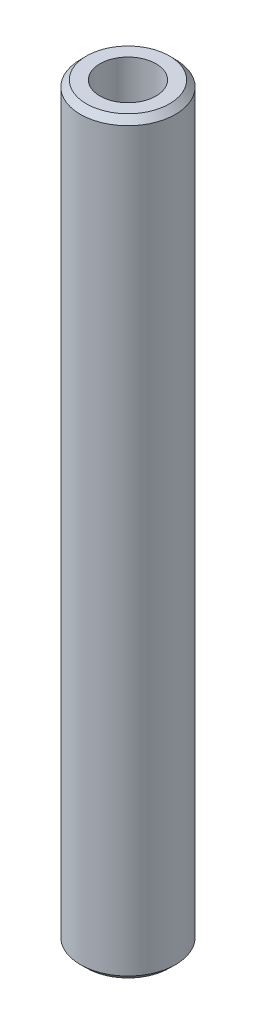
from build123d import *
from OCP.BRepFilletAPI import BRepFilletAPI_MakeChamfer

# Parameters (mm, degrees)
SKETCH1_R           = 37.5
BOSS_EXTRUDE1_DEPTH = 590.780436454
SKETCH2_R           = 22.11409809
CUT_EXTRUDE1_DEPTH  = 594.155986311
CHAMFER1_SIZE       = 4.839235391
CHAMFER1_SIZE2      = 4.740828213


with BuildPart() as part:
    # Sketch1 → Boss-Extrude1 (new body)
    with BuildSketch(Plane(origin=(0, 0, 0), x_dir=(1, 0, 0), z_dir=(0, 1, 0))):
        Circle(SKETCH1_R)
    extrude(amount=BOSS_EXTRUDE1_DEPTH)

    # Sketch2 → Cut-Extrude1 (cut, through all)
    with BuildSketch(Plane(origin=(0, 0, 0), x_dir=(1, 0, 0), z_dir=(0, 1, 0))):
        Circle(SKETCH2_R)
    extrude(amount=CUT_EXTRUDE1_DEPTH, mode=Mode.SUBTRACT)

    # Chamfer1: one chamfer whose edges measure the first distance from different faces: ONE call of the kernel's chamfer builder (chamfer() names one face for all edges)
    chamfer1_edges_1 = [part.edges().sort_by_distance(p)[0] for p in [
        (-37.5, 590.780436454, 0),
    ]]
    chamfer1_side_1 = [part.faces().sort_by_distance(p)[0] for p in [
        (-37.5, 295.390218227, 0),
    ]]
    chamfer1_edges_2 = [part.edges().sort_by_distance(p)[0] for p in [
        (-37.5, 0, 0),
    ]]
    chamfer1_side_2 = [part.faces().sort_by_distance(p)[0] for p in [
        (-36.439339828, 0, 0),
    ]]
    chamfer1 = BRepFilletAPI_MakeChamfer(part.part.solid().wrapped)
    for e in chamfer1_edges_1:
        chamfer1.Add(CHAMFER1_SIZE, CHAMFER1_SIZE2, e.wrapped, chamfer1_side_1[0].wrapped)  # the first distance lies on this face
    for e in chamfer1_edges_2:
        chamfer1.Add(CHAMFER1_SIZE, CHAMFER1_SIZE2, e.wrapped, chamfer1_side_2[0].wrapped)  # the first distance lies on this face
    add(Compound.cast(chamfer1.Shape()), mode=Mode.REPLACE)


solid = part.part
